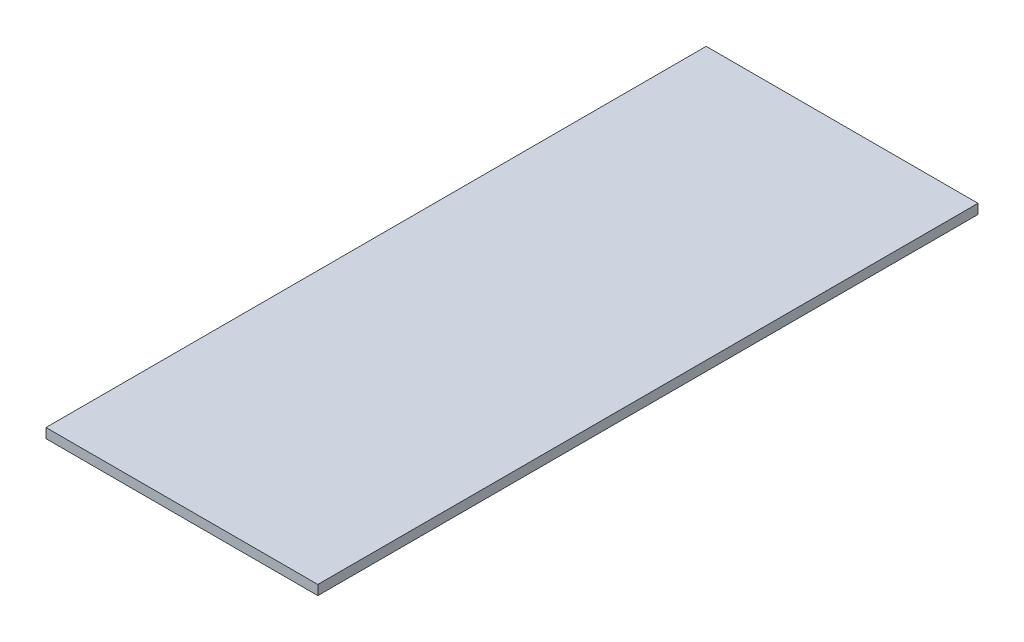
from build123d import *

# Parameters (mm, degrees)
SKETCH1_W           = 140
SKETCH1_H           = 340
BOSS_EXTRUDE1_DEPTH = 5


with BuildPart() as part:
    # Sketch1 → Boss-Extrude1 (new body)
    with BuildSketch(Plane(origin=(0, 0, 0), x_dir=(1, 0, 0), z_dir=(0, 1, 0))):
        Rectangle(SKETCH1_W, SKETCH1_H)
    extrude(amount=BOSS_EXTRUDE1_DEPTH)


solid = part.part
